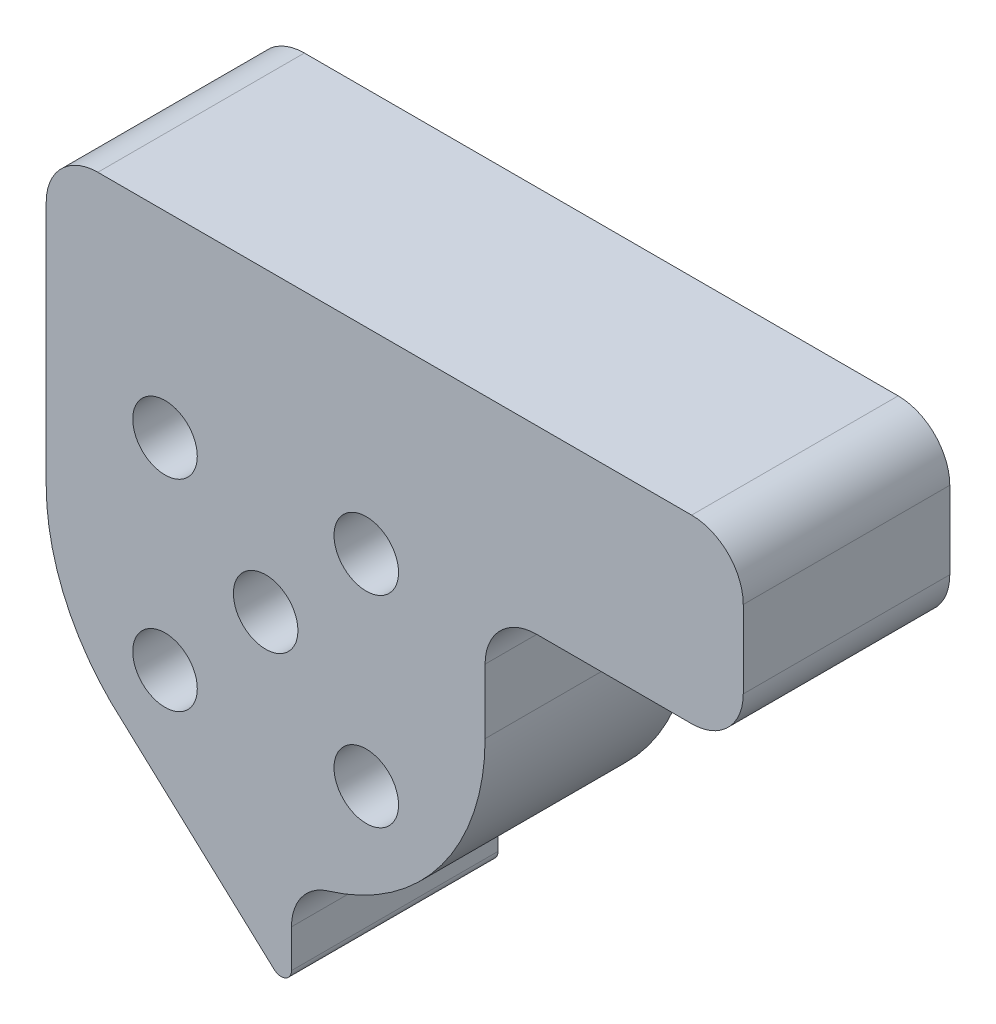
from build123d import *

# Parameters (mm, degrees)
SKETCH1_R           = 1.5875
BOSS_EXTRUDE1_DEPTH = 10.16
FILLET1_R           = 2.54
FILLET2_R           = 0.508


with BuildPart() as part:
    # Sketch1 → Boss-Extrude1 (new body)
    with BuildSketch(Plane.XY):
        with BuildLine():
            Line((10.795, 0), (10.795, 5.715))
            Line((10.795, 5.715), (23.495, 5.715))
            Line((23.495, 5.715), (23.495, 10.795))
            Line((23.495, 10.795), (23.495, 14.605))
            Line((23.495, 14.605), (-10.795, 14.605))
            Line((-10.795, 14.605), (-10.795, 0))
            ThreePointArc((-10.795, 0), (-9.969702227, -4.139693527), (-7.62, -7.646412558))
            Line((-7.62, -7.646412558), (1.27, -15.800033815))
            Line((1.27, -15.800033815), (1.27, -10.720033815))
            ThreePointArc((1.27, -10.720033815), (8.069748292, -7.170159517), (10.795, 0))
        make_face()
        Circle(SKETCH1_R, mode=Mode.SUBTRACT)
        with Locations((-4.95, 4.95)):
            Circle(SKETCH1_R, mode=Mode.SUBTRACT)
        with Locations((-4.95, -4.95)):
            Circle(SKETCH1_R, mode=Mode.SUBTRACT)
        with Locations((4.95, -4.95)):
            Circle(SKETCH1_R, mode=Mode.SUBTRACT)
        with Locations((4.95, 4.95)):
            Circle(SKETCH1_R, mode=Mode.SUBTRACT)
    extrude(amount=BOSS_EXTRUDE1_DEPTH)

    # Fillet1
    fillet1_edges = [part.edges().sort_by_distance(p)[0] for p in [
        (23.495, 5.715, 5.08),
        (23.495, 14.605, 5.08),
        (-10.795, 14.605, 5.08),
        (1.27, -10.720033815, 5.08),
        (10.795, 5.715, 5.08),
    ]]
    fillet(fillet1_edges, radius=FILLET1_R)

    # Fillet2
    fillet2_edges = [part.edges().sort_by_distance(p)[0] for p in [
        (1.27, -15.800033815, 5.08),
    ]]
    fillet(fillet2_edges, radius=FILLET2_R)


solid = part.part
